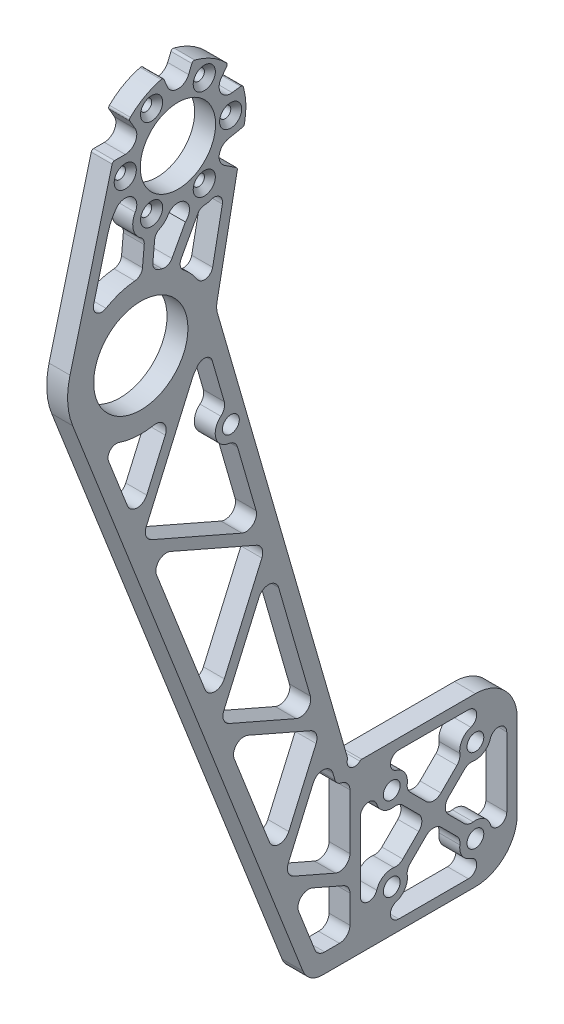
from build123d import *

# Parameters (mm, degrees)
BOSS_EXTRUDE1_DEPTH           = 6.35
SKETCH2_R                     = 2.5527
SKETCH2_R_2                   = 14.3129
CUT_EXTRUDE1_DEPTH            = 212.894086161
F_10_CLEARANCE_HOLE1_D        = 5.1054
SKETCH15_R                    = 2.2987
CUT_EXTRUDE3_DEPTH            = 212.894086161
BOSS_EXTRUDE2_DEPTH           = 6.35
SKETCH3_R                     = 11.43
CUT_EXTRUDE2_DEPTH            = 251.449389073
CSK_FOR_M3_SFHCS1_D           = 3.4
CSK_FOR_M3_SFHCS1_CSINK_D     = 6.72
CSK_FOR_M3_SFHCS1_CSINK_ANGLE = 90
FILLET2_R                     = 6.35
CUT_EXTRUDE4_DEPTH            = 251.449389073
FILLET3_R                     = 3.175
F_8_0MM_DOWEL_HOLE1_D         = 7
CUT_EXTRUDE5_START            = -6.35
CUT_EXTRUDE5_DEPTH            = 6.35
CUT_EXTRUDE6_DEPTH            = 251.037112426
FILLET4_R                     = 0.762


# Read off the part's stored shape, not the designer's step: Cut-Extrude5
with BuildPart() as part:
    # Sketch1 → Boss-Extrude1 (new body)
    with BuildSketch(Plane(origin=(0, 0, 0), x_dir=(0, 0, -1), z_dir=(1, 0, 0))):
        with BuildLine():
            Line((-50.8, 0), (-12.7, 0))
            ThreePointArc((-12.7, 0), (-3.719743879, -3.719743879), (0, -12.7))
            Line((0, -12.7), (0, -38.1))
            ThreePointArc((0, -38.1), (-3.719743879, -47.080256121), (-12.7, -50.8))
            Line((-12.7, -50.8), (-63.5, -50.8))
            Line((-63.5, -50.8), (-134.992152149, 131.589176094))
            ThreePointArc((-134.992152149, 131.589176094), (-121.447745966, 160.744247494), (-92.948454798, 145.869452365))
            Line((-92.948454798, 145.869452365), (-50.8, 0))
        make_face()
    extrude(amount=BOSS_EXTRUDE1_DEPTH)

    # Sketch2 → Cut-Extrude1 (cut, through all)
    with BuildSketch(Plane(origin=(6.35, 0, 0), x_dir=(0, 0, -1), z_dir=(1, 0, 0))):
        with Locations((-38.1, -12.7)):
            Circle(SKETCH2_R)
        with Locations((-12.7, -12.7)):
            Circle(SKETCH2_R)
        with Locations((-12.7, -38.1)):
            Circle(SKETCH2_R)
        with Locations((-38.1, -38.1)):
            Circle(SKETCH2_R)
        with Locations((-114.3, 139.7)):
            Circle(SKETCH2_R_2)
    extrude(amount=-CUT_EXTRUDE1_DEPTH, mode=Mode.SUBTRACT)

    # #10 Clearance Hole1 (through all)
    with Locations(Plane(origin=(6.35, 0, 0), x_dir=(0, 0, -1), z_dir=(1, 0, 0))):
        with Locations((-86.947581859, 107.94477794)):
            Hole(F_10_CLEARANCE_HOLE1_D / 2)

    # Sketch15 → Cut-Extrude3 (cut, through all)
    with BuildSketch(Plane(origin=(6.35, 0, 0), x_dir=(0, 0, -1), z_dir=(1, 0, 0))):
        with Locations((-49.354178765, 1.445821235)):
            Circle(SKETCH15_R)
    extrude(amount=-CUT_EXTRUDE3_DEPTH, mode=Mode.SUBTRACT)

    # Sketch4 → Boss-Extrude2 (add)
    with BuildSketch(Plane(origin=(0, 0, 0), x_dir=(0, 0, -1), z_dir=(1, 0, 0))):
        with BuildLine():
            Line((-122.993495231, 194.440237572), (-135.805803237, 145.308123763))
            ThreePointArc((-135.805803237, 145.308123763), (-109.366671599, 161.370553659), (-92.485863738, 135.446285841))
            Line((-92.485863738, 135.446285841), (-82.767837125, 185.282816644))
            ThreePointArc((-82.767837125, 185.282816644), (-98.442872996, 209.355351047), (-122.993495231, 194.440237572))
        make_face()
    extrude(amount=BOSS_EXTRUDE2_DEPTH)

    # Sketch3 → Cut-Extrude2 (cut, through all)
    with BuildSketch(Plane(origin=(6.35, 0, 0), x_dir=(0, 0, -1), z_dir=(1, 0, 0))):
        with Locations((-103.023820797, 189.232694078)):
            Circle(SKETCH3_R)
    extrude(amount=-CUT_EXTRUDE2_DEPTH, mode=Mode.SUBTRACT)

    # CSK for M3 SFHCS1 (through all)
    with Locations(Plane(origin=(6.35, 0, 0), x_dir=(0, 0, -1), z_dir=(1, 0, 0))):
        with Locations((-119.023820797, 189.232694078), (-111.023820797, 203.089100538), (-95.023820797, 203.089100538), (-87.023820797, 189.232694078), (-95.023820797, 175.376287617), (-111.023820797, 175.376287617)):
            CounterSinkHole(CSK_FOR_M3_SFHCS1_D / 2, CSK_FOR_M3_SFHCS1_CSINK_D / 2, counter_sink_angle=CSK_FOR_M3_SFHCS1_CSINK_ANGLE)

    # Fillet2
    fillet2_edges = [part.edges().sort_by_distance(p)[0] for p in [
        (3.175, -50.8, 63.5),
        (3.175, 140.713719763, 91.458724364),
    ]]
    fillet(fillet2_edges, radius=FILLET2_R)

    # Sketch16 → Cut-Extrude4 (cut, through all)
    with BuildSketch(Plane(origin=(6.35, 0, 0), x_dir=(0, 0, -1), z_dir=(1, 0, 0))):
        with BuildLine():
            Line((-47.625, -35.970145251), (-47.625, -14.829854749))
            ThreePointArc((-47.625, -14.829854749), (-45.459502569, -12.317615145), (-42.655434783, -14.089035706))
            ThreePointArc((-42.655434783, -14.089035706), (-40.018605846, -17.058939992), (-36.047532015, -16.997532015))
            Line((-36.047532015, -16.997532015), (-27.64506403, -25.4))
            Line((-27.64506403, -25.4), (-36.047532015, -33.802467985))
            ThreePointArc((-36.047532015, -33.802467985), (-40.018605846, -33.741060008), (-42.655434783, -36.710964294))
            ThreePointArc((-42.655434783, -36.710964294), (-45.459502569, -38.482384855), (-47.625, -35.970145251))
        make_face()
        with BuildLine():
            Line((-113.935394907, 90.919687282), (-77.419428448, 74.969274406))
            Line((-77.419428448, 74.969274406), (-85.625556352, 103.369446825))
            ThreePointArc((-85.625556352, 103.369446825), (-91.522912974, 106.622752433), (-88.269607366, 112.520109055))
            Line((-88.269607366, 112.520109055), (-92.600830841, 127.509821))
            ThreePointArc((-92.600830841, 127.509821), (-94.650481677, 129.314539453), (-97.151581963, 128.217919828))
            ThreePointArc((-97.151581963, 128.217919828), (-97.729354332, 127.398776142), (-98.346220903, 126.60865405))
            Line((-98.346220903, 126.60865405), (-113.935394907, 90.919687282))
        make_face()
        with BuildLine():
            Line((-124.08603429, 116.815770952), (-115.574028789, 95.100133311))
            Line((-115.574028789, 95.100133311), (-103.871511825, 121.891208895))
            ThreePointArc((-103.871511825, 121.891208895), (-112.200479976, 119.169573265), (-120.907932857, 120.148999268))
            ThreePointArc((-120.907932857, 120.148999268), (-123.559535884, 119.495486734), (-124.08603429, 116.815770952))
        make_face()
        with BuildLine():
            Line((-55.370114256, -1.34008027), (-58.417826696, 9.207593348))
            Line((-58.417826696, 9.207593348), (-70.79729711, -19.133260895))
            Line((-70.79729711, -19.133260895), (-50.8, -27.868211006))
            Line((-50.8, -27.868211006), (-50.8, -3.175))
            Line((-50.8, -3.175), (-52.929937661, -3.175))
            ThreePointArc((-52.929937661, -3.175), (-54.456485419, -2.665086684), (-55.370114256, -1.34008027))
        make_face()
        Polygon((-112.296761026, 86.739241253), (-76.273717143, 71.004140181), (-92.008818214, 34.981096298), align=None)
        Polygon((-90.370184333, 30.800650269), (-74.894312671, 66.230229112), (-60.942942474, 17.946638642), align=None)
        Polygon((-88.731550451, 26.62020424), (-72.435930991, -14.952814866), (-59.797231168, 13.981504417), align=None)
        Polygon((-60.646657727, -45.029344565), (-50.8, -45.029344565), (-50.8, -31.332891043), (-69.158663228, -23.313706924), align=None)
        with BuildLine():
            Line((-14.829854749, -3.175), (-35.970145251, -3.175))
            ThreePointArc((-35.970145251, -3.175), (-38.482384855, -5.340497431), (-36.710964294, -8.144565217))
            ThreePointArc((-36.710964294, -8.144565217), (-33.741060008, -10.781394154), (-33.802467985, -14.752467985))
            Line((-33.802467985, -14.752467985), (-25.4, -23.15493597))
            Line((-25.4, -23.15493597), (-16.997532015, -14.752467985))
            ThreePointArc((-16.997532015, -14.752467985), (-17.058939992, -10.781394154), (-14.089035706, -8.144565217))
            ThreePointArc((-14.089035706, -8.144565217), (-12.317615145, -5.340497431), (-14.829854749, -3.175))
        make_face()
        with BuildLine():
            Line((-3.175, -35.970145251), (-3.175, -14.829854749))
            ThreePointArc((-3.175, -14.829854749), (-5.340497431, -12.317615145), (-8.144565217, -14.089035706))
            ThreePointArc((-8.144565217, -14.089035706), (-10.781394154, -17.058939992), (-14.752467985, -16.997532015))
            Line((-14.752467985, -16.997532015), (-23.15493597, -25.4))
            Line((-23.15493597, -25.4), (-14.752467985, -33.802467985))
            ThreePointArc((-14.752467985, -33.802467985), (-10.781394154, -33.741060008), (-8.144565217, -36.710964294))
            ThreePointArc((-8.144565217, -36.710964294), (-5.340497431, -38.482384855), (-3.175, -35.970145251))
        make_face()
        with BuildLine():
            Line((-35.970145251, -47.625), (-14.829854749, -47.625))
            ThreePointArc((-14.829854749, -47.625), (-12.317615145, -45.459502569), (-14.089035706, -42.655434783))
            ThreePointArc((-14.089035706, -42.655434783), (-17.058939992, -40.018605846), (-16.997532015, -36.047532015))
            Line((-16.997532015, -36.047532015), (-25.4, -27.64506403))
            Line((-25.4, -27.64506403), (-33.802467985, -36.047532015))
            ThreePointArc((-33.802467985, -36.047532015), (-33.741060008, -40.018605846), (-36.710964294, -42.655434783))
            ThreePointArc((-36.710964294, -42.655434783), (-38.482384855, -45.459502569), (-35.970145251, -47.625))
        make_face()
    extrude(amount=-CUT_EXTRUDE4_DEPTH, mode=Mode.SUBTRACT)

    # Fillet3
    fillet3_edges = [part.edges().sort_by_distance(p)[0] for p in [
        (3.175, 74.969274406, 77.419428448),
        (3.175, 112.520109055, 88.269607366),
        (3.175, 103.369446825, 85.625556352),
        (3.175, -23.15493597, 25.4),
        (3.175, -14.752467985, 33.802467985),
        (3.175, -14.752467985, 16.997532015),
        (3.175, 34.981096298, 92.008818214),
        (3.175, 86.739241253, 112.296761026),
        (3.175, 66.230229112, 74.894312671),
        (3.175, 17.946638642, 60.942942474),
        (3.175, 30.800650269, 90.370184333),
        (3.175, 26.62020424, 88.731550451),
        (3.175, 13.981504417, 59.797231168),
        (3.175, -14.952814866, 72.435930991),
        (3.175, 9.207593348, 58.417826696),
        (3.175, -45.029344565, 50.8),
        (3.175, -45.029344565, 60.646657727),
        (3.175, -27.64506403, 25.4),
        (3.175, -36.047532015, 16.997532015),
        (3.175, -36.047532015, 33.802467985),
        (3.175, -33.802467985, 14.752467985),
        (3.175, -25.4, 23.15493597),
        (3.175, -16.997532015, 14.752467985),
        (3.175, -16.997532015, 36.047532015),
        (3.175, -25.4, 27.64506403),
        (3.175, -33.802467985, 36.047532015),
        (3.175, 71.004140181, 76.273717143),
        (3.175, 90.919687282, 113.935394907),
        (3.175, 126.60865405, 98.346220903),
        (3.175, -27.868211006, 50.8),
        (3.175, -19.133260895, 70.79729711),
        (3.175, -3.175, 50.8),
        (3.175, -31.332891043, 50.8),
        (3.175, -23.313706924, 69.158663228),
        (3.175, 121.891208895, 103.871511825),
        (3.175, 95.100133311, 115.574028789),
    ]]
    fillet(fillet3_edges, radius=FILLET3_R)

    # Ø8.0mm Dowel Hole1 (through all)
    with Locations(Plane(origin=(6.35, 0, 0), x_dir=(0, 0, -1), z_dir=(1, 0, 0))):
        with Locations((-103.023820797, 207.707902692), (-87.023820797, 198.470298385), (-87.023820797, 179.995089771), (-103.023820797, 170.757485464), (-119.023820797, 179.995089771), (-119.023820797, 198.470298385)):
            Hole(F_8_0MM_DOWEL_HOLE1_D / 2)

    # Cut-Extrude5 outline → Cut-Extrude5 (cut)
    with BuildSketch(Plane(origin=(6.35, 0, 0), x_dir=(0, 0, -1), z_dir=(1, 0, 0)).offset(CUT_EXTRUDE5_START)):
        with BuildLine():
            ThreePointArc((-122.169666272, 196.93613534), (-122.53292156, 195.963325079), (-122.846783506, 194.973474137))
            Line((-122.846783506, 194.973474137), (-119.026729368, 194.970299594))
            ThreePointArc((-119.026729368, 194.970299594), (-120.879835494, 195.502941068), (-122.169666272, 196.93613534))
        make_face()
        with BuildLine():
            ThreePointArc((-84.202944845, 177.923216496), (-86.41095714, 176.549164911), (-88.957337016, 177.07763968))
            Line((-88.957337016, 177.07763968), (-84.893069644, 174.384079676))
            Line((-84.893069644, 174.384079676), (-84.202944845, 177.923216496))
        make_face()
        with BuildLine():
            Line((-83.631186346, 180.855340597), (-82.941061547, 184.394477418))
            Line((-82.941061547, 184.394477418), (-87.71956711, 183.425240943))
            ThreePointArc((-87.71956711, 183.425240943), (-85.161188693, 182.95829777), (-83.631186346, 180.855340597))
        make_face()
        with BuildLine():
            ThreePointArc((-83.877975322, 196.93613534), (-84.978885581, 195.629833641), (-86.566979124, 195.00024137))
            Line((-86.566979124, 195.00024137), (-83.337367213, 195.425427844))
            ThreePointArc((-83.337367213, 195.425427844), (-83.592983917, 196.186037474), (-83.877975322, 196.93613534))
        make_face()
        with BuildLine():
            ThreePointArc((-86.779522229, 201.961762005), (-87.286630334, 202.583620734), (-87.817529244, 203.185296109))
            Line((-87.817529244, 203.185296109), (-89.800557488, 200.600963386))
            ThreePointArc((-89.800557488, 200.600963386), (-88.461267816, 201.661496603), (-86.779522229, 201.961762005))
        make_face()
        with BuildLine():
            ThreePointArc((-100.12227389, 209.665203267), (-99.541438563, 208.058636166), (-99.790242434, 206.368510678))
            Line((-99.790242434, 206.368510678), (-98.543658766, 209.378029875))
            ThreePointArc((-98.543658766, 209.378029875), (-99.330174381, 209.53696413), (-100.12227389, 209.665203267))
        make_face()
        with BuildLine():
            ThreePointArc((-105.925367705, 209.665203267), (-106.717467214, 209.53696413), (-107.503982829, 209.378029875))
            Line((-107.503982829, 209.378029875), (-106.257399161, 206.368510678))
            ThreePointArc((-106.257399161, 206.368510678), (-106.506203032, 208.058636165), (-105.925367705, 209.665203267))
        make_face()
        with BuildLine():
            ThreePointArc((-119.268119365, 201.961762005), (-117.379453182, 201.559967485), (-115.991278645, 200.217778884))
            Line((-115.991278645, 200.217778884), (-117.902379264, 203.534264068))
            ThreePointArc((-117.902379264, 203.534264068), (-118.60509957, 202.765253262), (-119.268119365, 201.961762005))
        make_face()
    extrude(amount=CUT_EXTRUDE5_DEPTH, mode=Mode.SUBTRACT)

    # Sketch22 → Cut-Extrude6 (cut, through all)
    with BuildSketch(Plane(origin=(6.35, 0, 0), x_dir=(0, 0, -1), z_dir=(1, 0, 0))):
        with BuildLine():
            Line((-113.260805756, 168.376392521), (-113.795238567, 162.556631907))
            ThreePointArc((-113.795238567, 162.556631907), (-114.532240087, 160.989165753), (-116.102722529, 160.258613711))
            ThreePointArc((-116.102722529, 160.258613711), (-120.646553151, 159.337404853), (-124.870080296, 157.425118019))
            ThreePointArc((-124.870080296, 157.425118019), (-127.696198226, 157.575560274), (-128.628819339, 160.247599436))
            Line((-128.628819339, 160.247599436), (-124.307506553, 176.818792663))
            ThreePointArc((-124.307506553, 176.818792663), (-123.328442435, 179.533649202), (-121.874051742, 182.026390723))
            ThreePointArc((-121.874051742, 182.026390723), (-117.131008967, 182.939111404), (-115.992731884, 178.245089771))
            ThreePointArc((-115.992731884, 178.245089771), (-116.627111812, 174.142094365), (-114.327601218, 170.685324164))
            ThreePointArc((-114.327601218, 170.685324164), (-113.484377765, 169.674007091), (-113.260805756, 168.376392521))
        make_face()
        with BuildLine():
            Line((-110.633541687, 162.266291004), (-110.099108876, 168.086051618))
            ThreePointArc((-110.099108876, 168.086051618), (-109.642947218, 169.321245755), (-108.629639718, 170.162076253))
            ThreePointArc((-108.629639718, 170.162076253), (-107.1600121, 171.13469764), (-106.05490971, 172.507485464))
            ThreePointArc((-106.05490971, 172.507485464), (-102.520198945, 174.221062376), (-99.619867779, 171.571797353))
            ThreePointArc((-99.619867779, 171.571797353), (-99.571690065, 170.650864682), (-99.85549311, 169.773428698))
            Line((-99.85549311, 169.773428698), (-104.855155619, 160.520070146))
            ThreePointArc((-104.855155619, 160.520070146), (-106.148762666, 159.368244554), (-107.879983499, 159.313510506))
            ThreePointArc((-107.879983499, 159.313510506), (-108.330020538, 159.455144937), (-108.783177697, 159.586454635))
            ThreePointArc((-108.783177697, 159.586454635), (-110.194342025, 160.590813447), (-110.633541687, 162.266291004))
        make_face()
        with BuildLine():
            Line((-92.48876895, 152.020272169), (-89.533794684, 167.174137442))
            ThreePointArc((-89.533794684, 167.174137442), (-90.397431012, 169.608770537), (-92.946468943, 170.027950262))
            ThreePointArc((-92.946468943, 170.027950262), (-93.892013202, 169.751421863), (-94.870924429, 169.640720872))
            ThreePointArc((-94.870924429, 169.640720872), (-96.133110749, 169.265655932), (-97.037910207, 168.309033772))
            Line((-97.037910207, 168.309033772), (-102.061815617, 159.010806541))
            ThreePointArc((-102.061815617, 159.010806541), (-102.316256059, 157.297511047), (-101.413210068, 155.819461886))
            ThreePointArc((-101.413210068, 155.819461886), (-99.072328205, 153.629264803), (-97.098874673, 151.102968636))
            ThreePointArc((-97.098874673, 151.102968636), (-94.486129561, 150.015246978), (-92.48876895, 152.020272169))
        make_face()
    extrude(amount=-CUT_EXTRUDE6_DEPTH, mode=Mode.SUBTRACT)

    # Fillet4
    fillet4_edges = [part.edges().sort_by_distance(p)[0] for p in [
        (3.175, 203.534264068, 117.902379264),
        (3.175, 209.378029875, 107.503982829),
        (3.175, 209.378029875, 98.543658766),
        (3.175, 203.185296109, 87.817529244),
        (3.175, 195.425427844, 83.337367213),
        (3.175, 184.394477418, 82.941061547),
        (3.175, 2.33393942, 51.47438342),
        (3.175, 0, 47.567107796),
        (3.175, 194.973474137, 122.846783506),
        (3.175, 174.384079676, 84.893069644),
    ]]
    fillet(fillet4_edges, radius=FILLET4_R)


solid = part.part
